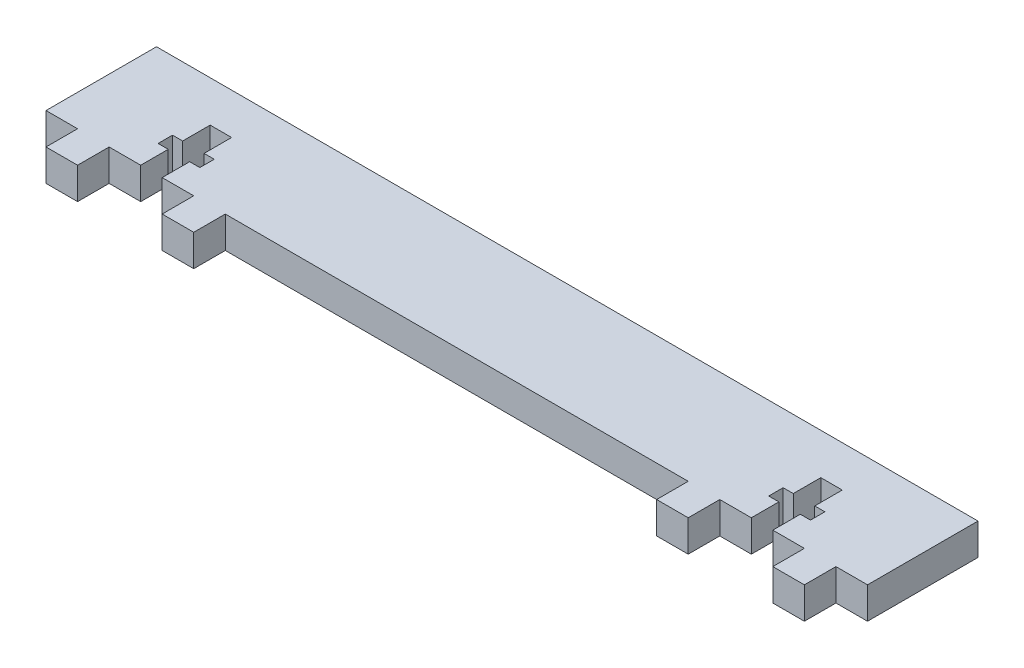
from build123d import *

# Parameters (mm, degrees)
BOSS_EXTRUDE1_DEPTH = 6.35


with BuildPart() as part:
    # Sketch1 → Boss-Extrude1 (new body)
    with BuildSketch(Plane(origin=(0, 0, 0), x_dir=(1, 0, 0), z_dir=(0, 1, 0))):
        Polygon((-82.6262, 11.1125), (-82.6262, -11.1125), (-76.2762, -11.1125), (-76.2762, -17.4625), (-69.9262, -17.4625), (-69.9262, -11.1125), (-63.5762, -11.1125), (-63.5762, -5.577500021), (-65.617199982, -5.577500021), (-65.617199982, -2.677499979), (-63.5762, -2.677499979), (-63.5762, 2.8575), (-59.2582, 2.8575), (-59.2582, -2.677499979), (-57.217200018, -2.677499979), (-57.217200018, -5.577500021), (-59.2582, -5.577500021), (-59.2582, -11.1125), (-52.9082, -11.1125), (-52.9082, -17.4625), (-46.5582, -17.4625), (-46.5582, -11.1125), (46.5582, -11.1125), (46.5582, -17.4625), (52.9082, -17.4625), (52.9082, -11.1125), (59.2582, -11.1125), (59.2582, -5.577500021), (57.217200018, -5.577500021), (57.217200018, -2.677499979), (59.2582, -2.677499979), (59.2582, 2.8575), (63.5762, 2.8575), (63.5762, -2.677499979), (65.617199982, -2.677499979), (65.617199982, -5.577500021), (63.5762, -5.577500021), (63.5762, -11.1125), (69.9262, -11.1125), (69.9262, -17.4625), (76.2762, -17.4625), (76.2762, -11.1125), (82.6262, -11.1125), (82.6262, 11.1125), align=None)
    extrude(amount=BOSS_EXTRUDE1_DEPTH)


solid = part.part
